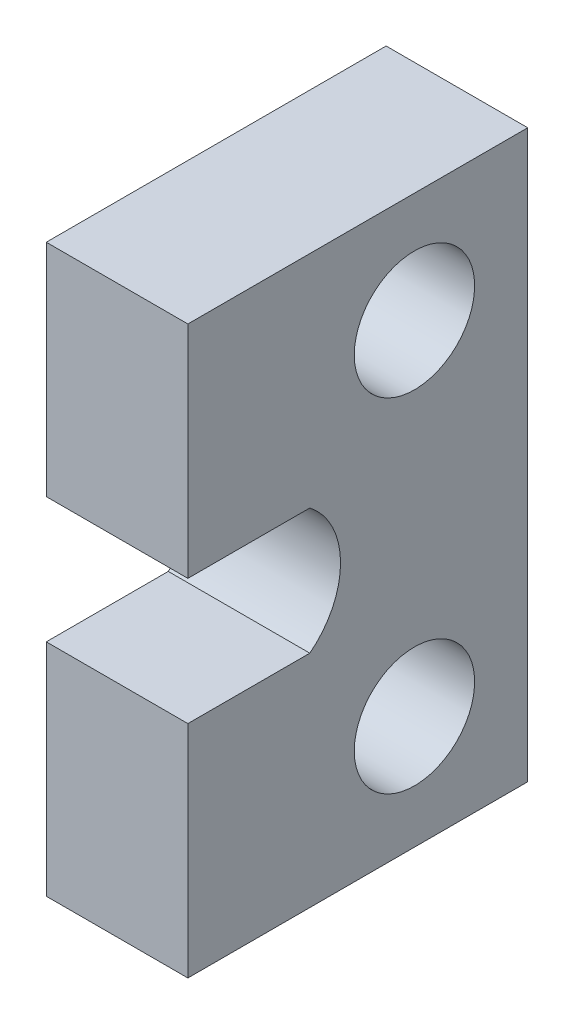
from build123d import *

# Parameters (mm, degrees)
SKETCH1_W           = 15.875
SKETCH1_H           = 63.5
BOSS_EXTRUDE1_DEPTH = 38.1
CUT_EXTRUDE1_DEPTH  = 76.735563806
SKETCH3_R           = 6.746875
CUT_EXTRUDE2_DEPTH  = 76.735563806


with BuildPart() as part:
    # Sketch1 → Boss-Extrude1 (new body)
    with BuildSketch(Plane.XY):
        with Locations((7.9375, 31.75)):
            Rectangle(SKETCH1_W, SKETCH1_H)
    extrude(amount=BOSS_EXTRUDE1_DEPTH)

    # Sketch2 → Cut-Extrude1 (cut, through all)
    with BuildSketch(Plane.ZY):
        with BuildLine():
            ThreePointArc((24.4280023, 38.7985), (20.984165451, 31.75), (24.4280023, 24.7015))
            Line((24.4280023, 24.7015), (38.1, 24.7015))
            Line((38.1, 24.7015), (38.1, 25.464164733))
            ThreePointArc((38.1, 25.464164733), (40.685, 31.75), (38.1, 38.035835267))
            Line((38.1, 38.035835267), (38.1, 38.7985))
            Line((38.1, 38.7985), (24.4280023, 38.7985))
        make_face()
    extrude(amount=-CUT_EXTRUDE1_DEPTH, mode=Mode.SUBTRACT)

    # Sketch3 → Cut-Extrude2 (cut, through all)
    with BuildSketch(Plane.ZY):
        with Locations((12.7, 51.14925)):
            Circle(SKETCH3_R)
        with Locations((12.7, 12.7)):
            Circle(SKETCH3_R)
    extrude(amount=-CUT_EXTRUDE2_DEPTH, mode=Mode.SUBTRACT)


solid = part.part
